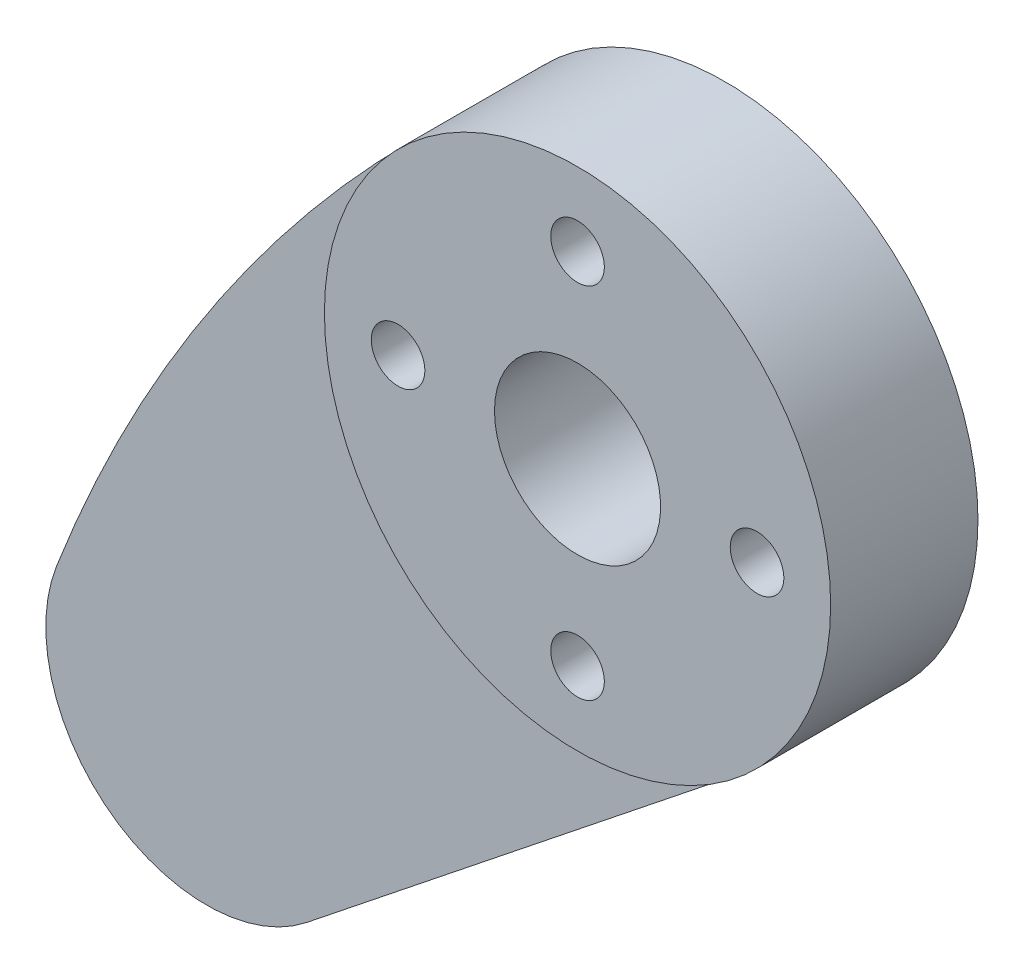
from build123d import *
from build123d.topology import SkipClean

# Parameters (mm, degrees)
SKETCH1_R           = 12
BOSS_EXTRUDE1_DEPTH = 3.175
BOSS_EXTRUDE2_START = 3.81
SKETCH2_R           = 12
BOSS_EXTRUDE2_DEPTH = 3.81
SKETCH3_R           = 3.937
CUT_EXTRUDE1_DEPTH  = 134.099089527
SKETCH4_R           = 1.27
CUT_EXTRUDE2_DEPTH  = 134.099089527
CUT_EXTRUDE3_DEPTH  = 133.970273023
CUT_EXTRUDE4_START  = -0.635
CUT_EXTRUDE4_DEPTH  = 0.635
BOSS_EXTRUDE3_START = -2.54
BOSS_EXTRUDE3_DEPTH = 2.54


with BuildPart() as part:
    # Sketch1 → Boss-Extrude1 (new body)
    with BuildSketch(Plane.XY):
        with BuildLine():
            ThreePointArc((79.156979953, 34.616777747), (78.764409425, 33.207913627), (78.648230314, 31.75))
            Line((78.648230314, 31.75), (93.886132052, 31.75))
            ThreePointArc((93.886132052, 31.75), (93.886918896, 31.813218964), (93.887181183, 31.876442281))
            ThreePointArc((93.887181183, 31.876442281), (87.66085737, 39.367908538), (79.156979953, 34.616777747))
        make_face()
        with BuildLine():
            ThreePointArc((87.4395, 24.347161532), (88.598049964, 24.621688616), (89.699693339, 25.073335615))
            ThreePointArc((89.699693339, 25.073335615), (92.723044454, 27.828451492), (93.886132052, 31.75))
            Line((93.886132052, 31.75), (78.648230314, 31.75))
            ThreePointArc((78.648230314, 31.75), (79.141141445, 29.177561465), (80.476005529, 26.924))
            Line((80.476005529, 26.924), (87.4395, 26.924))
            Line((87.4395, 26.924), (87.4395, 24.347161532))
        make_face()
        with BuildLine():
            Line((87.4395, 26.924), (80.476005529, 26.924))
            ThreePointArc((80.476005529, 26.924), (82.246043304, 25.403819152), (84.393093646, 24.490496444))
            ThreePointArc((84.393093646, 24.490496444), (85.909052633, 24.264862685), (87.4395, 24.347161532))
            Line((87.4395, 24.347161532), (87.4395, 26.924))
        make_face()
        with BuildLine():
            ThreePointArc((89.699693339, 25.073335615), (94.483227873, 27.711788353), (99.06, 30.694537484))
            Line((99.06, 30.694537484), (99.06, 31.75))
            Line((99.06, 31.75), (93.886132052, 31.75))
            ThreePointArc((93.886132052, 31.75), (92.723044454, 27.828451492), (89.699693339, 25.073335615))
        make_face()
        with BuildLine():
            ThreePointArc((99.06, 30.694537484), (106.888760949, 37.054762789), (113.784062988, 44.416608597))
            ThreePointArc((113.784062988, 44.416608597), (96.436063978, 43.110085278), (96.014300162, 60.502100346))
            ThreePointArc((96.014300162, 60.502100346), (86.225733854, 48.445051897), (79.156979953, 34.616777747))
            ThreePointArc((79.156979953, 34.616777747), (87.66085737, 39.367908538), (93.887181183, 31.876442281))
            ThreePointArc((93.887181183, 31.876442281), (93.886918896, 31.813218964), (93.886132052, 31.75))
            Line((93.886132052, 31.75), (99.06, 31.75))
            Line((99.06, 31.75), (99.06, 30.694537484))
        make_face()
        with Locations((104.48925, 52.0065)):
            Circle(SKETCH1_R)
    extrude(amount=BOSS_EXTRUDE1_DEPTH)

    # Sketch2 → Boss-Extrude2 (add)
    with SkipClean():  # the faces are left unmerged after this step: merging them gives an invalid solid
        with BuildSketch(Plane(origin=(0, 0, 0), x_dir=(-1, 0, 0), z_dir=(0, 0, -1)).offset(BOSS_EXTRUDE2_START)):
            with Locations((-104.48925, 52.0065)):
                Circle(SKETCH2_R)
        extrude(amount=-BOSS_EXTRUDE2_DEPTH)

    # Sketch3 → Cut-Extrude1 (cut, through all)
    with SkipClean():  # the faces are left unmerged after this step: merging them gives an invalid solid
        with BuildSketch(Plane(origin=(0, 0, -3.81), x_dir=(-1, 0, 0), z_dir=(0, 0, -1))):
            with Locations((-104.48925, 52.0065)):
                Circle(SKETCH3_R)
        extrude(amount=-CUT_EXTRUDE1_DEPTH, mode=Mode.SUBTRACT)

    # Sketch4 → Cut-Extrude2 (cut, through all)
    with SkipClean():  # the faces are left unmerged after this step: merging them gives an invalid solid
        with BuildSketch(Plane(origin=(0, 0, -3.81), x_dir=(-1, 0, 0), z_dir=(0, 0, -1))):
            with Locations((-112.99825, 52.0065)):
                Circle(SKETCH4_R)
            with Locations((-95.98025, 52.0065)):
                Circle(SKETCH4_R)
            with Locations((-104.48925, 60.5155)):
                Circle(SKETCH4_R)
            with Locations((-104.48925, 43.4975)):
                Circle(SKETCH4_R)
        extrude(amount=-CUT_EXTRUDE2_DEPTH, mode=Mode.SUBTRACT)

    # Sketch5 → Cut-Extrude3 (cut, through all)
    with SkipClean():  # the faces are left unmerged after this step: merging them gives an invalid solid
        with BuildSketch(Plane(origin=(0, 0, 0), x_dir=(-1, 0, 0), z_dir=(0, 0, -1))):
            with BuildLine():
                ThreePointArc((-104.430493989, 40.006643845), (-109.606684651, 41.15238269), (-113.7840634, 44.4166091))
                ThreePointArc((-113.7840634, 44.4166091), (-102.758092767, 33.479680706), (-89.699693406, 25.073335649))
                ThreePointArc((-89.699693406, 25.073335649), (-92.462895691, 27.440507008), (-93.81346398, 30.819079549))
                ThreePointArc((-93.81346398, 30.819079549), (-97.397477458, 37.40567327), (-104.430493989, 40.006643845))
            make_face()
        extrude(amount=-CUT_EXTRUDE3_DEPTH, mode=Mode.SUBTRACT)
    add(part.part.scale(1), mode=Mode.REPLACE)  # the faces are merged on a copy

    # Sketch6 → Cut-Extrude4 (cut)
    with BuildSketch(Plane.XY.offset(3.175).offset(CUT_EXTRUDE4_START)):
        with BuildLine():
            ThreePointArc((96.014299675, 60.502099861), (86.225733771, 48.44505177), (79.156980092, 34.616778107))
            ThreePointArc((79.156980092, 34.616778107), (84.355854315, 24.500045491), (93.81346398, 30.819079549))
            ThreePointArc((93.81346398, 30.819079549), (97.397477458, 37.40567327), (104.430493989, 40.006643845))
            ThreePointArc((104.430493989, 40.006643845), (93.388711037, 47.448207038), (96.014299675, 60.502099861))
        make_face()
    extrude(amount=CUT_EXTRUDE4_DEPTH, mode=Mode.SUBTRACT)

    # Sketch7 → Boss-Extrude3 (add)
    with BuildSketch(Plane.XY.offset(2.54).offset(BOSS_EXTRUDE3_START)):
        with BuildLine():
            ThreePointArc((93.81346398, 30.819079549), (92.885787929, 28.100406696), (91.017515109, 25.918361416))
            Line((91.017515109, 25.918361416), (111.970090828, 42.623695489))
            ThreePointArc((111.970090828, 42.623695489), (108.424231015, 40.670013577), (104.430493989, 40.006643845))
            ThreePointArc((104.430493989, 40.006643845), (97.397477458, 37.40567327), (93.81346398, 30.819079549))
        make_face()
    extrude(amount=BOSS_EXTRUDE3_DEPTH)


solid = part.part
